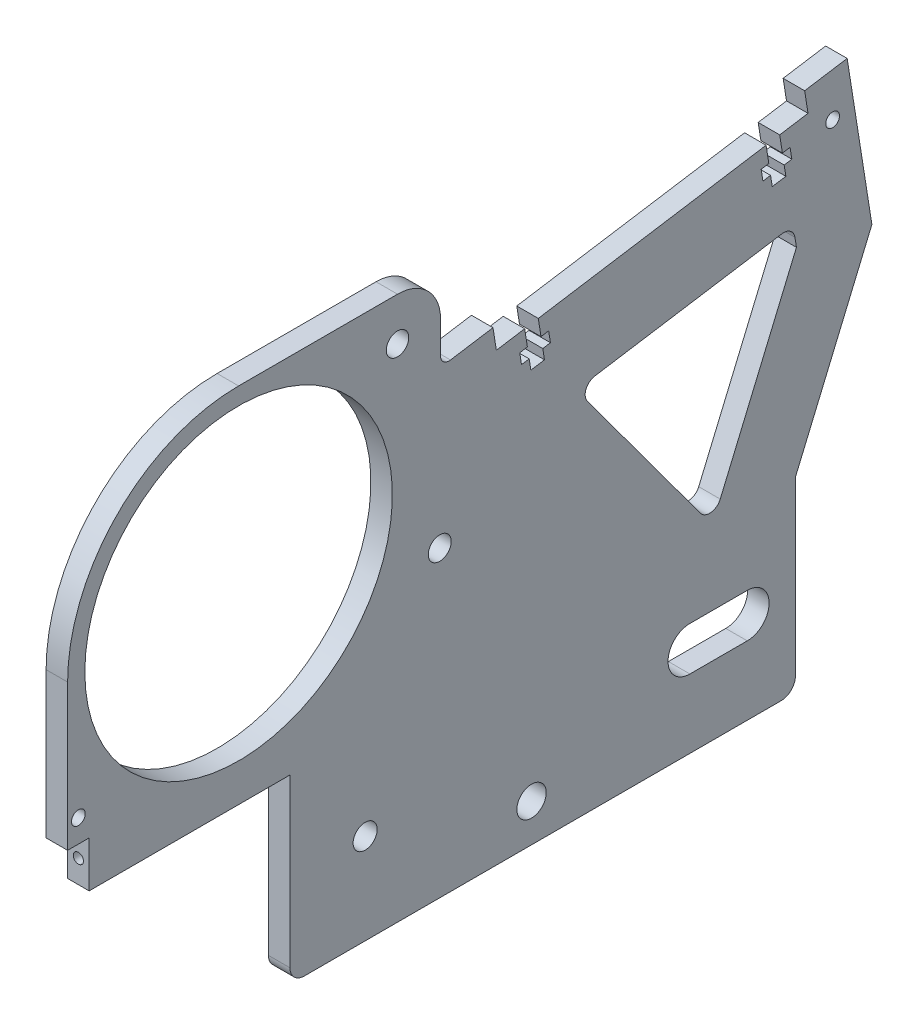
from build123d import *

# Parameters (mm, degrees)
SKETCH1_R           = 1.524
SKETCH1_R_2         = 2.667
SKETCH1_R_3         = 34.04
SKETCH1_R_4         = 3.2512
SKETCH1_R_5         = 2.54
SKETCH1_R_6         = 2.4892
BOSS_EXTRUDE1_DEPTH = 4.7625
SKETCH2_R           = 1.1303
CUT_EXTRUDE1_DEPTH  = 6.35


with BuildPart() as part:
    # Sketch1 → Boss-Extrude1 (new body)
    with BuildSketch(Plane(origin=(0, 0, 0), x_dir=(0, 0, -1), z_dir=(1, 0, 0))):
        with BuildLine():
            Line((-28.170295117, 0), (77.382795117, 0))
            ThreePointArc((77.382795117, 0), (79.627859148, 0.92993597), (80.557795117, 3.175))
            Line((80.557795117, 3.175), (80.557795117, 38.504743526))
            Line((80.557795117, 38.504743526), (80.557795117, 41.307035595))
            Line((80.557795117, 41.307035595), (97.47645297, 81.253872056))
            Line((97.47645297, 81.253872056), (92.000706017, 115.826377673))
            Line((92.000706017, 115.826377673), (82.592974573, 114.336339393))
            Line((82.592974573, 114.336339393), (83.337993713, 109.632473671))
            Line((83.337993713, 109.632473671), (77.06617275, 108.639114818))
            Line((77.06617275, 108.639114818), (77.667154856, 104.844663135))
            Line((77.667154856, 104.844663135), (79.360546516, 105.112870026))
            Line((79.360546516, 105.112870026), (79.752923263, 102.635500745))
            Line((79.752923263, 102.635500745), (78.059531603, 102.367293855))
            Line((78.059531603, 102.367293855), (78.432041173, 100.015360994))
            Line((78.432041173, 100.015360994), (75.421567111, 99.538548745))
            Line((75.421567111, 99.538548745), (75.049057541, 101.890481606))
            Line((75.049057541, 101.890481606), (73.355665881, 101.622274715))
            Line((73.355665881, 101.622274715), (72.963289134, 104.099643996))
            Line((72.963289134, 104.099643996), (74.656680794, 104.367850886))
            Line((74.656680794, 104.367850886), (74.055698688, 108.162302569))
            Line((74.055698688, 108.162302569), (23.630258147, 100.17569739))
            Line((23.630258147, 100.17569739), (24.231240253, 96.381245708))
            Line((24.231240253, 96.381245708), (25.924631913, 96.649452598))
            Line((25.924631913, 96.649452598), (26.31700866, 94.172083318))
            Line((26.31700866, 94.172083318), (24.623617, 93.903876428))
            Line((24.623617, 93.903876428), (24.99612657, 91.551943567))
            Line((24.99612657, 91.551943567), (21.985652508, 91.075131317))
            Line((21.985652508, 91.075131317), (21.613142938, 93.427064178))
            Line((21.613142938, 93.427064178), (19.919751278, 93.158857288))
            Line((19.919751278, 93.158857288), (19.527374531, 95.636226568))
            Line((19.527374531, 95.636226568), (21.220766191, 95.904433458))
            Line((21.220766191, 95.904433458), (20.619784085, 99.698885141))
            Line((20.619784085, 99.698885141), (14.347963122, 98.705526288))
            Line((14.347963122, 98.705526288), (13.602943983, 103.40939201))
            Line((13.602943983, 103.40939201), (4.195212538, 101.91935373))
            ThreePointArc((4.195212538, 101.91935373), (2.66000635, 102.352326655), (1.992204883, 103.800900019))
            Line((1.992204883, 103.800900019), (1.992204883, 110.875))
            ThreePointArc((1.992204883, 110.875), (-0.797603027, 117.610192091), (-7.532795117, 120.4))
            Line((-7.532795117, 120.4), (-42.707795117, 120.4))
            ThreePointArc((-42.707795117, 120.4), (-69.471786785, 109.313991668), (-80.557795117, 82.55))
            Line((-80.557795117, 82.55), (-80.557795117, 50.292))
            Line((-80.557795117, 50.292), (-75.795295117, 50.292))
            Line((-75.795295117, 50.292), (-75.795295117, 40.132))
            Line((-75.795295117, 40.132), (-31.345295117, 40.132))
            Line((-31.345295117, 40.132), (-31.345295117, 3.175))
            ThreePointArc((-31.345295117, 3.175), (-30.415359148, 0.92993597), (-28.170295117, 0))
        make_face()
        with Locations((-78.176545117, 55.372)):
            Circle(SKETCH1_R, mode=Mode.SUBTRACT)
        with Locations((-14.692204883, 20.066)):
            Circle(SKETCH1_R_2, mode=Mode.SUBTRACT)
        with Locations((-42.707795117, 82.55)):
            Circle(SKETCH1_R_3, mode=Mode.SUBTRACT)
        with Locations((22.137795117, 8.382)):
            Circle(SKETCH1_R_4, mode=Mode.SUBTRACT)
        with Locations((1.817795117, 67.06)):
            Circle(SKETCH1_R_5, mode=Mode.SUBTRACT)
        with Locations((88.786878575, 105.673627089)):
            Circle(SKETCH1_R, mode=Mode.SUBTRACT)
        with Locations((-7.532795117, 110.875)):
            Circle(SKETCH1_R_6, mode=Mode.SUBTRACT)
        with BuildLine():
            Line((69.889795117, 15.2273), (57.189795117, 15.2273))
            ThreePointArc((57.189795117, 15.2273), (52.351095117, 20.066), (57.189795117, 24.9047))
            Line((57.189795117, 24.9047), (69.889795117, 24.9047))
            ThreePointArc((69.889795117, 24.9047), (74.728495117, 20.066), (69.889795117, 15.2273))
        make_face(mode=Mode.SUBTRACT)
        with BuildLine():
            Line((77.537520924, 89.426308388), (36.148497, 82.870930999))
            ThreePointArc((36.148497, 82.870930999), (34.19606201, 81.326640718), (34.500615909, 78.855996716))
            Line((34.500615909, 78.855996716), (59.521631273, 44.880829698))
            ThreePointArc((59.521631273, 44.880829698), (61.863545391, 43.864422793), (63.905732826, 45.396452563))
            Line((63.905732826, 45.396452563), (80.774519188, 85.225536877))
            Line((80.774519188, 85.225536877), (80.44359285, 87.314923545))
            ThreePointArc((80.44359285, 87.314923545), (79.427839006, 88.972483169), (77.537520924, 89.426308388))
        make_face(mode=Mode.SUBTRACT)
    extrude(amount=BOSS_EXTRUDE1_DEPTH)

    # Sketch2 → Cut-Extrude1 (cut)
    with BuildSketch(Plane.XY.offset(75.795295117)):
        with Locations((2.38125, 45.212)):
            Circle(SKETCH2_R)
    extrude(amount=-CUT_EXTRUDE1_DEPTH, mode=Mode.SUBTRACT)


solid = part.part
